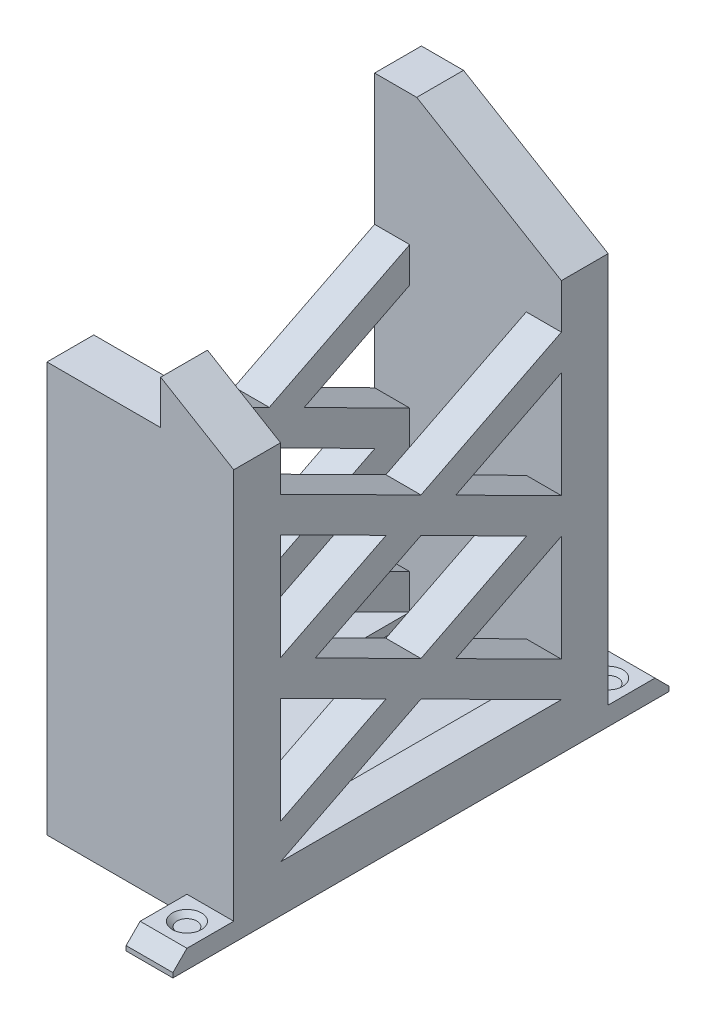
from build123d import *

# Parameters (mm, degrees)
BOSS_EXTRUDE1_DEPTH      = 80
SKETCH2_W                = 60
SKETCH2_H                = 28
CUT_EXTRUDE1_DEPTH       = 80
SKETCH3_W                = 39.904961116
SKETCH3_H                = 80
BOSS_EXTRUDE2_DEPTH      = 70
CUT_EXTRUDE4_REACH       = 115.545
SKETCH6_W                = 24.904961116
SKETCH6_H                = 60
CUT_EXTRUDE5_DEPTH       = 70
SKETCH7_W                = 10
SKETCH7_H                = 4
BOSS_EXTRUDE3_DEPTH      = 13
SKETCH8_R                = 3.1
CUT_EXTRUDE6_DEPTH       = 1
CHAMFER1_SIZE            = 1
CHAMFER2_SIZE            = 3
CHAMFER2_OF_MIRROR1_SIZE = 3
SKETCH9_W                = 10
SKETCH9_H                = 4
BOSS_EXTRUDE4_DEPTH      = 13
SKETCH10_R               = 3.1
CUT_EXTRUDE7_DEPTH       = 1
CHAMFER3_SIZE            = 3
CHAMFER4_SIZE            = 1
CHAMFER5_SIZE            = 1
CUT_EXTRUDE8_REACH       = 125.05


with BuildPart() as part:
    # Sketch1 → Boss-Extrude1 (new body)
    with BuildSketch(Plane.XY):
        Polygon((9, 36), (39.904961116, 17.536972664), (39.904961116, 0), (0, 0), (0, 36), align=None)
    extrude(amount=BOSS_EXTRUDE1_DEPTH)

    # Sketch2 → Cut-Extrude1 (cut)
    with BuildSketch(Plane.ZY):
        with Locations((40, 22)):
            Rectangle(SKETCH2_W, SKETCH2_H)
    extrude(amount=-CUT_EXTRUDE1_DEPTH, mode=Mode.SUBTRACT)

    # Sketch3 → Boss-Extrude2 (add)
    with BuildSketch(Plane.XZ):
        with Locations((19.952480558, 40)):
            Rectangle(SKETCH3_W, SKETCH3_H)
    extrude(amount=BOSS_EXTRUDE2_DEPTH)

    # Sketch4 → Cut-Extrude4 (cut, up to next)
    with BuildSketch(Plane(origin=(39.904961116, 0, 0), x_dir=(0, 0, -1), z_dir=(1, 0, 0)), mode=Mode.PRIVATE) as cut_extrude4_sk1:
        Polygon((-10, 8), (-40, -7.119896394), (-70, 8), align=None)
    cut_extrude4_tool1 = extrude(cut_extrude4_sk1.sketch, amount=-CUT_EXTRUDE4_REACH, mode=Mode.PRIVATE) & part.part
    # Sketch4 → Cut-Extrude4 (cut, up to next)
    with BuildSketch(Plane(origin=(39.904961116, 0, 0), x_dir=(0, 0, -1), z_dir=(1, 0, 0)), mode=Mode.PRIVATE) as cut_extrude4_sk2:
        Polygon((-47.440527175, -10.869896394), (-70, 0.5), (-70, -22.239792788), align=None)
    cut_extrude4_tool2 = extrude(cut_extrude4_sk2.sketch, amount=-CUT_EXTRUDE4_REACH, mode=Mode.PRIVATE) & part.part
    # Sketch4 → Cut-Extrude4 (cut, up to next)
    with BuildSketch(Plane(origin=(39.904961116, 0, 0), x_dir=(0, 0, -1), z_dir=(1, 0, 0)), mode=Mode.PRIVATE) as cut_extrude4_sk3:
        Polygon((-47.440527175, -41.130103606), (-70, -29.760207212), (-70, -52.5), align=None)
    cut_extrude4_tool3 = extrude(cut_extrude4_sk3.sketch, amount=-CUT_EXTRUDE4_REACH, mode=Mode.PRIVATE) & part.part
    # Sketch4 → Cut-Extrude4 (cut, up to next)
    with BuildSketch(Plane(origin=(39.904961116, 0, 0), x_dir=(0, 0, -1), z_dir=(1, 0, 0)), mode=Mode.PRIVATE) as cut_extrude4_sk4:
        Polygon((-10, -60), (-40, -44.880103606), (-70, -60), align=None)
    cut_extrude4_tool4 = extrude(cut_extrude4_sk4.sketch, amount=-CUT_EXTRUDE4_REACH, mode=Mode.PRIVATE) & part.part
    # Sketch4 → Cut-Extrude4 (cut, up to next)
    with BuildSketch(Plane(origin=(39.904961116, 0, 0), x_dir=(0, 0, -1), z_dir=(1, 0, 0)), mode=Mode.PRIVATE) as cut_extrude4_sk5:
        Polygon((-10, -52.5), (-10, -29.760207212), (-32.559472825, -41.130103606), align=None)
    cut_extrude4_tool5 = extrude(cut_extrude4_sk5.sketch, amount=-CUT_EXTRUDE4_REACH, mode=Mode.PRIVATE) & part.part
    # Sketch4 → Cut-Extrude4 (cut, up to next)
    with BuildSketch(Plane(origin=(39.904961116, 0, 0), x_dir=(0, 0, -1), z_dir=(1, 0, 0)), mode=Mode.PRIVATE) as cut_extrude4_sk6:
        Polygon((-62.579725368, -26), (-40, -14.619896394), (-17.420274632, -26), (-40, -37.380103606), align=None)
    cut_extrude4_tool6 = extrude(cut_extrude4_sk6.sketch, amount=-CUT_EXTRUDE4_REACH, mode=Mode.PRIVATE) & part.part
    # Sketch4 → Cut-Extrude4 (cut, up to next)
    with BuildSketch(Plane(origin=(39.904961116, 0, 0), x_dir=(0, 0, -1), z_dir=(1, 0, 0)), mode=Mode.PRIVATE) as cut_extrude4_sk7:
        Polygon((-10, -22.239792788), (-10, 0.5), (-32.559472825, -10.869896394), align=None)
    cut_extrude4_tool7 = extrude(cut_extrude4_sk7.sketch, amount=-CUT_EXTRUDE4_REACH, mode=Mode.PRIVATE) & part.part
    add(cut_extrude4_tool1.solids().sort_by_distance((39.904961, 2.960035, 40))[0], mode=Mode.SUBTRACT)
    add(cut_extrude4_tool2.solids().sort_by_distance((39.904961, -10.869896, 62.480176))[0], mode=Mode.SUBTRACT)
    add(cut_extrude4_tool3.solids().sort_by_distance((39.904961, -41.130104, 62.480176))[0], mode=Mode.SUBTRACT)
    add(cut_extrude4_tool4.solids().sort_by_distance((39.904961, -54.960035, 40))[0], mode=Mode.SUBTRACT)
    add(cut_extrude4_tool5.solids().sort_by_distance((39.904961, -41.130104, 17.519824))[0], mode=Mode.SUBTRACT)
    add(cut_extrude4_tool6.solids().sort_by_distance((39.904961, -26, 40))[0], mode=Mode.SUBTRACT)
    add(cut_extrude4_tool7.solids().sort_by_distance((39.904961, -10.869896, 17.519824))[0], mode=Mode.SUBTRACT)

    # Sketch6 → Cut-Extrude5 (cut)
    with BuildSketch(Plane(origin=(0, 8, 0), x_dir=(1, 0, 0), z_dir=(0, 1, 0))):
        with Locations((19.952480558, -40)):
            Rectangle(SKETCH6_W, SKETCH6_H)
    extrude(amount=-CUT_EXTRUDE5_DEPTH, mode=Mode.SUBTRACT)

    # Sketch7 → Boss-Extrude3 (add)
    with BuildSketch(Plane(origin=(0, 0, 0), x_dir=(-1, 0, 0), z_dir=(0, 0, -1))):
        with Locations((-34.904961116, -68)):
            Rectangle(SKETCH7_W, SKETCH7_H)
    boss_extrude3 = extrude(amount=BOSS_EXTRUDE3_DEPTH)

    # Sketch8 → Cut-Extrude6 (cut)
    with BuildSketch(Plane(origin=(0, -66, 0), x_dir=(1, 0, 0), z_dir=(0, 1, 0))):
        with Locations(Location((34.904961116, 5, 0), (0, 0, 270))):
            Circle(SKETCH8_R)
    cut_extrude6 = extrude(amount=-CUT_EXTRUDE6_DEPTH, mode=Mode.SUBTRACT)

    # Chamfer1
    chamfer1_edges = [part.edges().sort_by_distance(p)[0] for p in [
        (34.904961116, -67, -8.1),
    ]]
    chamfer(chamfer1_edges, length=CHAMFER1_SIZE - 0.0001)  # a hair under: the kernel refuses the full size

    # Chamfer2
    chamfer2_edges = [part.edges().sort_by_distance(p)[0] for p in [
        (34.904961116, -66, -13),
    ]]
    chamfer(chamfer2_edges, length=CHAMFER2_SIZE)

    # Mirror1: Boss-Extrude3, Cut-Extrude6 across plane
    add(boss_extrude3.mirror(Plane.XY.offset(40)))
    add(cut_extrude6.mirror(Plane.XY.offset(40)), mode=Mode.SUBTRACT)

    # Chamfer2 of Mirror1
    chamfer2_of_mirror1_edges = [part.edges().sort_by_distance(p)[0] for p in [
        (34.904961116, -66, 93),
    ]]
    chamfer(chamfer2_of_mirror1_edges, length=CHAMFER2_OF_MIRROR1_SIZE)

    # Sketch9 → Boss-Extrude4 (add)
    with BuildSketch(Plane.ZY):
        with Locations((40, -68)):
            Rectangle(SKETCH9_W, SKETCH9_H)
    extrude(amount=BOSS_EXTRUDE4_DEPTH)

    # Sketch10 → Cut-Extrude7 (cut)
    with BuildSketch(Plane(origin=(0, -66, 0), x_dir=(1, 0, 0), z_dir=(0, 1, 0))):
        with Locations(Location((-5, -40, 0), (0, 0, 270))):
            Circle(SKETCH10_R)
    extrude(amount=-CUT_EXTRUDE7_DEPTH, mode=Mode.SUBTRACT)

    # Chamfer3
    chamfer3_edges = [part.edges().sort_by_distance(p)[0] for p in [
        (-13, -66, 40),
    ]]
    chamfer(chamfer3_edges, length=CHAMFER3_SIZE)

    # Chamfer4
    chamfer4_edges = [part.edges().sort_by_distance(p)[0] for p in [
        (-5, -67, 36.9),
    ]]
    chamfer(chamfer4_edges, length=CHAMFER4_SIZE - 0.0001)  # a hair under: the kernel refuses the full size

    # Chamfer5
    chamfer5_edges = [part.edges().sort_by_distance(p)[0] for p in [
        (34.904961116, -67, 88.1),
    ]]
    chamfer(chamfer5_edges, length=CHAMFER5_SIZE - 0.0001)  # a hair under: the kernel refuses the full size

    # Sketch11 → Cut-Extrude8 (cut, up to next)
    with BuildSketch(Plane.XY.offset(80), mode=Mode.PRIVATE) as cut_extrude8_sk1:
        Polygon((0, 17.536972664), (0, 36), (9, 36), (24.289010788, 26.866145307), (24.289010788, 17.536972664), align=None)
    cut_extrude8_tool1 = extrude(cut_extrude8_sk1.sketch, amount=-CUT_EXTRUDE8_REACH, mode=Mode.PRIVATE) & part.part
    add(cut_extrude8_tool1.solids().sort_by_distance((10.844723, 25.627535, 80))[0], mode=Mode.SUBTRACT)


solid = part.part
